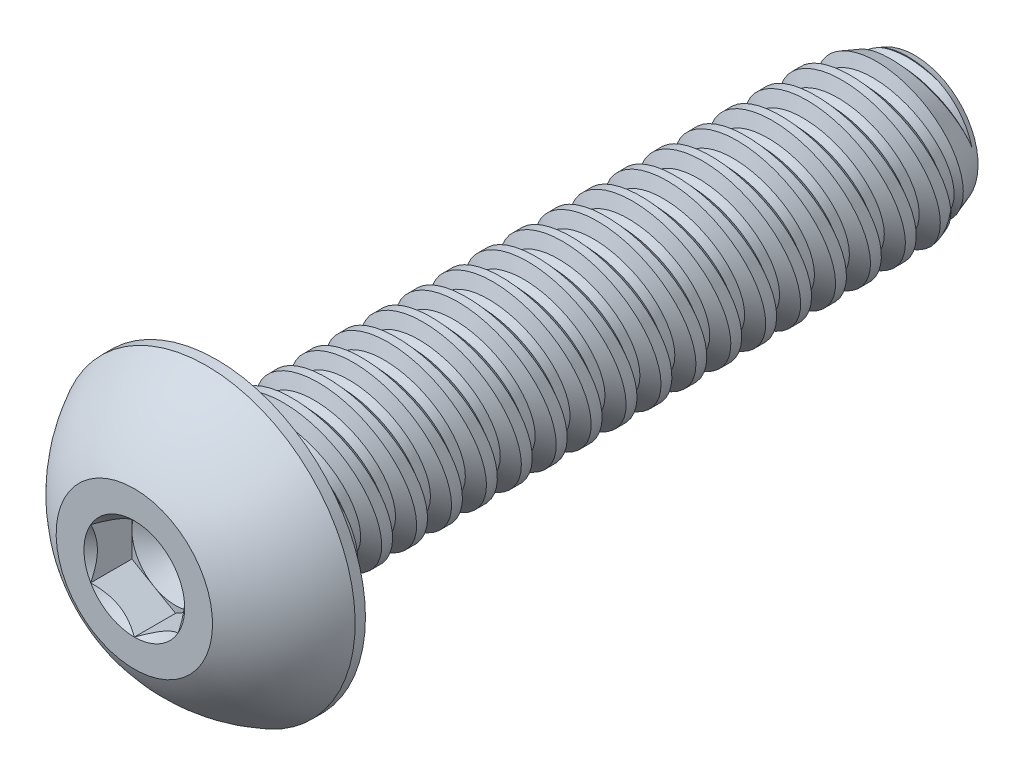
from build123d import *

# Parameters (mm, degrees)
SKETCH1_W          = 12.7
SKETCH1_H          = 1.4224
LPATTERN1_COUNT    = 20
LPATTERN1_PITCH    = 0.635
LPATTERN2_COUNT    = 2
LPATTERN2_PITCH    = 0.635
SKETCH4_R          = 2.7051
EXTRUDE1_DEPTH     = 1.4986
CUT_EXTRUDE1_DEPTH = 0.7493
SKETCH7_R          = 0.916543552
CUT_EXTRUDE4_DEPTH = 0.7493
CUT_EXTRUDE4_DRAFT = -45
SKETCH8_R          = 0.79375
CUT_EXTRUDE5_DEPTH = 0.249766667
CUT_EXTRUDE5_DRAFT = -60


with BuildPart() as part:
    # Sketch1 → Revolve1 (revolve)
    with BuildSketch(Plane(origin=(0, 0, 0), x_dir=(0, 0, -1), z_dir=(1, 0, 0)), mode=Mode.PRIVATE) as revolve1_sk:
        with Locations((6.35, 0.7112)):
            Rectangle(SKETCH1_W, SKETCH1_H)
    revolve(revolve1_sk.sketch.rotate(Axis((0, 0, 0), (0, 0, 1)), 143.822582937), axis=Axis((0, 0, 0), (0, 0, 1)))

    # Sketch2 → Cut-Revolve1 (revolve, cut)
    with BuildSketch(Plane(origin=(0, 0, 0), x_dir=(0, 0, -1), z_dir=(1, 0, 0)), mode=Mode.PRIVATE) as cut_revolve1_sk:
        Polygon((0.077468538, 1.439692084), (0.619748307, 1.560736676), (0.500953883, 1.182057853), (0.346016806, 1.147473684), align=None)
    cut_revolve1 = revolve(cut_revolve1_sk.sketch.rotate(Axis((0, -0.152561988, 0), (0, 0.2178530325871701, -0.9759815859905214)), 180), axis=Axis((0, -0.152561988, 0), (0, 0.2178530325871701, -0.9759815859905214)), mode=Mode.SUBTRACT)

    # Sketch3 → Cut-Revolve2 (revolve, cut)
    with BuildSketch(Plane(origin=(0, 0, 0), x_dir=(0, 0, -1), z_dir=(1, 0, 0)), mode=Mode.PRIVATE) as cut_revolve2_sk:
        Polygon((12.7, 1.147473684), (11.944646156, 1.4224), (12.7, 1.4224), align=None)
    revolve(cut_revolve2_sk.sketch.rotate(Axis((0, 0, -11.944646156), (0, 0, 1)), 143.822582937), axis=Axis((0, 0, -11.944646156), (0, 0, 1)), mode=Mode.SUBTRACT)

    # LPattern1: Cut-Revolve1 ×20
    with Locations(*[(0, 0, -i * LPATTERN1_PITCH) for i in range(1, LPATTERN1_COUNT)]):
        add(cut_revolve1, mode=Mode.SUBTRACT)

    # LPattern2: Cut-Revolve1 ×2
    with Locations(*[(0, 0, i * LPATTERN2_PITCH) for i in range(1, LPATTERN2_COUNT)]):
        add(cut_revolve1, mode=Mode.SUBTRACT)

    # Sketch4 → Extrude1 (add)
    with BuildSketch(Plane.XY):
        with Locations(Location((0, 0, 0), (0, 0, 90))):
            Circle(SKETCH4_R)
    extrude(amount=EXTRUDE1_DEPTH)

    # Sketch9 → Cut-Revolve3 (revolve, cut)
    with BuildSketch(Plane(origin=(0, 0, 0), x_dir=(0, 0, -1), z_dir=(1, 0, 0))):
        with BuildLine():
            Line((0, 2.7051), (-0.187325, 2.7051))
            ThreePointArc((-0.187325, 2.7051), (-0.942390011, 2.16539248), (-1.4986, 1.4224))
            Line((-1.4986, 1.4224), (-1.685925, 1.4224))
            Line((-1.685925, 1.4224), (-1.685925, 2.892425))
            Line((-1.685925, 2.892425), (0, 2.892425))
            Line((0, 2.892425), (0, 2.7051))
        make_face()
    revolve(axis=Axis((0, 0, 0), (0, 0, 1)), mode=Mode.SUBTRACT)

    # Sketch6 → Cut-Extrude1 (cut)
    with BuildSketch(Plane.XY.offset(1.4986)):
        Polygon((0, -0.916543552), (0.79375, -0.458271776), (0.79375, 0.458271776), (0, 0.916543552), (-0.79375, 0.458271776), (-0.79375, -0.458271776), align=None)
    extrude(amount=-CUT_EXTRUDE1_DEPTH, mode=Mode.SUBTRACT)


with BuildPart() as cut_extrude4_tool:
    # Sketch7 → Cut-Extrude4 (with draft: the straight prism first)
    with BuildSketch(Plane.XY.offset(1.4986)):
        Circle(SKETCH7_R)
    extrude(amount=-CUT_EXTRUDE4_DEPTH)
    # Cut-Extrude4: the draft: its side faces are tilted about the plane it starts from
    cut_extrude4_sides = [cut_extrude4_tool.faces().sort_by_distance(p)[0] for p in [
        (-0.916543552, 0, 1.12395),
    ]]
    draft(cut_extrude4_sides, Plane.XY.offset(1.4986), CUT_EXTRUDE4_DRAFT)


with BuildPart() as part_1:
    add(part.part)

    # Cut-Extrude4: cut by cut_extrude4_tool
    add(cut_extrude4_tool.part, mode=Mode.SUBTRACT)


with BuildPart() as cut_extrude5_tool:
    # Sketch8 → Cut-Extrude5 (with draft: the straight prism first)
    with BuildSketch(Plane.XY.offset(0.7493)):
        Circle(SKETCH8_R)
    extrude(amount=-CUT_EXTRUDE5_DEPTH)
    # Cut-Extrude5: the draft: its side faces are tilted about the plane it starts from
    cut_extrude5_sides = [cut_extrude5_tool.faces().sort_by_distance(p)[0] for p in [
        (-0.79375, 0, 0.624416667),
    ]]
    draft(cut_extrude5_sides, Plane.XY.offset(0.7493), CUT_EXTRUDE5_DRAFT)


with BuildPart() as part_2:
    add(part_1.part)

    # Cut-Extrude5: cut by cut_extrude5_tool
    add(cut_extrude5_tool.part, mode=Mode.SUBTRACT)


solid = part_2.part
